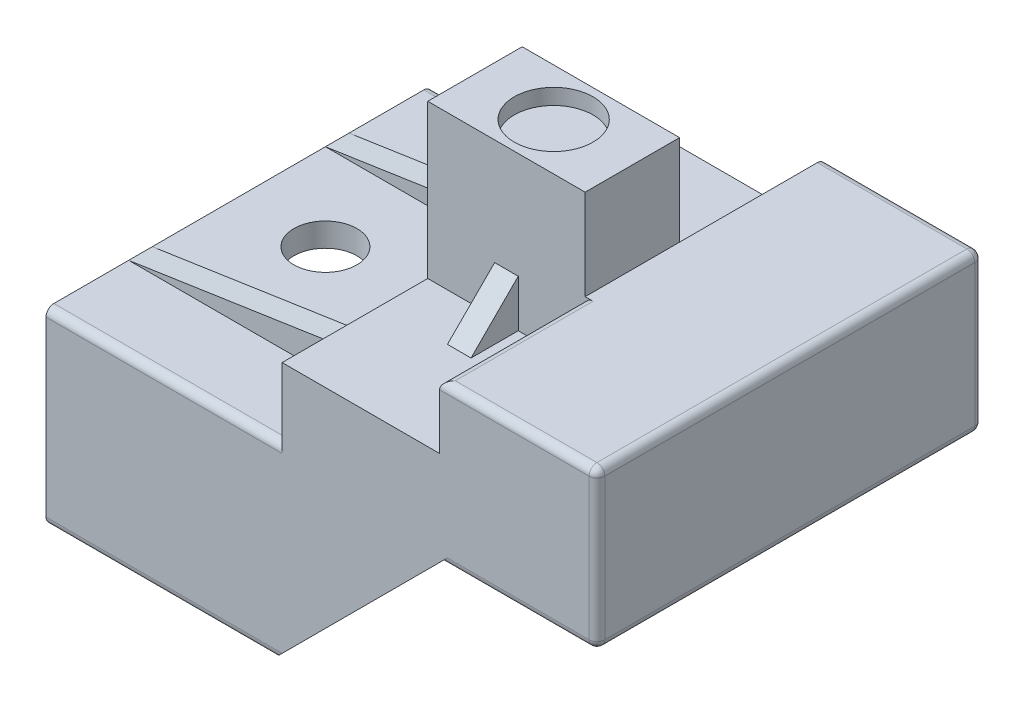
from build123d import *

# Parameters (mm, degrees)
EXTRUDE_1_DEPTH         = 30
EXTRUDE_1_DEPTH_BACK    = 40
SKETCH_2_W              = 49
SKETCH_2_H              = 24
SKETCH_2_W_2            = 43
SKETCH_2_H_2            = 18
EXTRUDE_1_2_DEPTH       = 6
SKETCH_1_3_W            = 20
SKETCH_1_3_H            = 8
EXTRUDE_2_DEPTH         = 24.5
CUT_EXTRUDE_1_DEPTH     = 25
RIB_1_REACH             = 58.032
SKETCH_4_WALLS_W        = 145.49538697
SKETCH_4_WALLS_H        = 3
RIB_2_REACH             = 65.649
SKETCH_6_WALLS_W        = 3
SKETCH_6_WALLS_H        = 137.784142328
CUT_EXTRUDE_START       = -12
CUT_EXTRUDE_2_OUTLINE_R = 4
CUT_EXTRUDE_2_DEPTH     = 3
FILLET_1_R              = 1
SKETCH_7_R              = 5
CUT_EXTRUDE_4_DEPTH     = 2


# Read off the part's stored shape, not the designer's step: 컷-돌출2
with BuildPart() as part:
    # 스케치2 → Extrude 1 (new, two sides: drawn at the far end of the back side and taken through both)
    with BuildSketch(Plane(origin=(0, 0, 0), x_dir=(0, 0, -1), z_dir=(1, 0, 0)).offset(-EXTRUDE_1_DEPTH_BACK)):
        with Locations((0, -21)):
            Rectangle(SKETCH_2_W, SKETCH_2_H)
        with Locations((0, -21)):
            Rectangle(SKETCH_2_W_2, SKETCH_2_H_2, mode=Mode.SUBTRACT)
    extrude(amount=EXTRUDE_1_DEPTH + EXTRUDE_1_DEPTH_BACK)



with BuildPart() as body_2:
    # 스케치1 → Extrude 1 2 (new, symmetric)
    with BuildSketch(Plane.XY):
        Polygon((-10, 19.5), (-10, 0), (10, 0), (10, 8), (10, 19.5), align=None)
    extrude(amount=EXTRUDE_1_2_DEPTH, both=True)


with BuildPart() as part_1:
    add(part.part)

    add(body_2.part)  # 보스-돌출2 merges body 2
    # 스케치1<3> → 보스-돌출2 (add, symmetric)
    with BuildSketch(Plane.XY):
        Polygon((10, 0), (-10, 0), (-10, -12), (10, -12), (30, -12), (30, 0), align=None)
        with Locations((20, 4)):
            Rectangle(SKETCH_1_3_W, SKETCH_1_3_H)
    extrude(amount=EXTRUDE_2_DEPTH, both=True)

    # 스케치1<4> → 컷-돌출1 (cut, symmetric)
    with BuildSketch(Plane.XY):
        Polygon((30, -12), (10, -12), (-11, -33), (30, -33), align=None)
    extrude(amount=CUT_EXTRUDE_1_DEPTH, both=True, mode=Mode.SUBTRACT)

    # 스케치4 walls → 보강대1 (add, up to next)
    with BuildSketch(Plane(origin=(0.4400978, -2.93398533, 0), x_dir=(0.9889363528682976, 0.14834045293024445, 0), z_dir=(-0.14834045293024445, 0.9889363528682976, 0)), mode=Mode.PRIVATE) as rib_1_sk1:
        with Locations((-25.177107795, -12.5)):
            Rectangle(SKETCH_4_WALLS_W, SKETCH_4_WALLS_H)
    rib_1_tool1 = extrude(rib_1_sk1.sketch, amount=-RIB_1_REACH, mode=Mode.PRIVATE) - part_1.part
    # 스케치4 walls → 보강대1 (add, up to next)
    with BuildSketch(Plane(origin=(0.4400978, -2.93398533, 0), x_dir=(0.9889363528682976, 0.14834045293024445, 0), z_dir=(-0.14834045293024445, 0.9889363528682976, 0)), mode=Mode.PRIVATE) as rib_1_sk2:
        with Locations((-25.177107795, 12.5)):
            Rectangle(SKETCH_4_WALLS_W, SKETCH_4_WALLS_H)
    rib_1_tool2 = extrude(rib_1_sk2.sketch, amount=-RIB_1_REACH, mode=Mode.PRIVATE) - part_1.part
    add(rib_1_tool1.solids().sort_by_distance((-24.458459359, -6.668768904, 12.5))[0])
    add(rib_1_tool2.solids().sort_by_distance((-24.458459359, -6.668768904, -12.5))[0])

    # 스케치6 walls → 보강대2 (add, up to next)
    with BuildSketch(Plane(origin=(0, 6, -6), x_dir=(1, 0, 0), z_dir=(0, 0.7071067811865477, -0.7071067811865474)), mode=Mode.PRIVATE) as rib_2_sk1:
        with Locations((0, 4.242640687)):
            Rectangle(SKETCH_6_WALLS_W, SKETCH_6_WALLS_H)
    rib_2_tool1 = extrude(rib_2_sk1.sketch, amount=-RIB_2_REACH, mode=Mode.PRIVATE) - part_1.part
    rib_2 = rib_2_tool1.solids().sort_by_distance((0, 3, -9))[0]
    add(rib_2)

    # 대칭 복사1: 보강대2 across plane
    add(rib_2.mirror(Plane.XY))

    # 컷-돌출2 outline → 컷-돌출2 (cut)
    with BuildSketch(Plane(origin=(0, 0, 0), x_dir=(1, 0, 0), z_dir=(0, 1, 0)).offset(CUT_EXTRUDE_START)):
        with Locations((-29, 0)):
            Circle(CUT_EXTRUDE_2_OUTLINE_R)
    extrude(amount=CUT_EXTRUDE_2_DEPTH, mode=Mode.SUBTRACT)

    # 필렛1
    fillet_1_edges = [part_1.edges().sort_by_distance(p)[0] for p in [
        (30, -2, 24.5),
        (30, -12, 0),
        (20, 8, -24.5),
        (30, 8, 0),
        (10, 8, 15.25),
        (20, 8, 24.5),
        (-25.5, -33, 24.5),
        (-25, -9, 24.5),
        (-25, -9, -24.5),
        (-25.5, -33, -24.5),
        (30, -2, -24.5),
        (20, -12, 24.5),
        (20, -12, -24.5),
    ]]
    fillet(fillet_1_edges, radius=FILLET_1_R)

    # 스케치7 → 컷-돌출4 (cut)
    with BuildSketch(Plane(origin=(0, 19.5, 0), x_dir=(1, 0, 0), z_dir=(0, 1, 0))):
        with Locations(Location((0, 0, 0), (0, 0, 270))):
            Circle(SKETCH_7_R)
    extrude(amount=-CUT_EXTRUDE_4_DEPTH, mode=Mode.SUBTRACT)


solid = part_1.part
